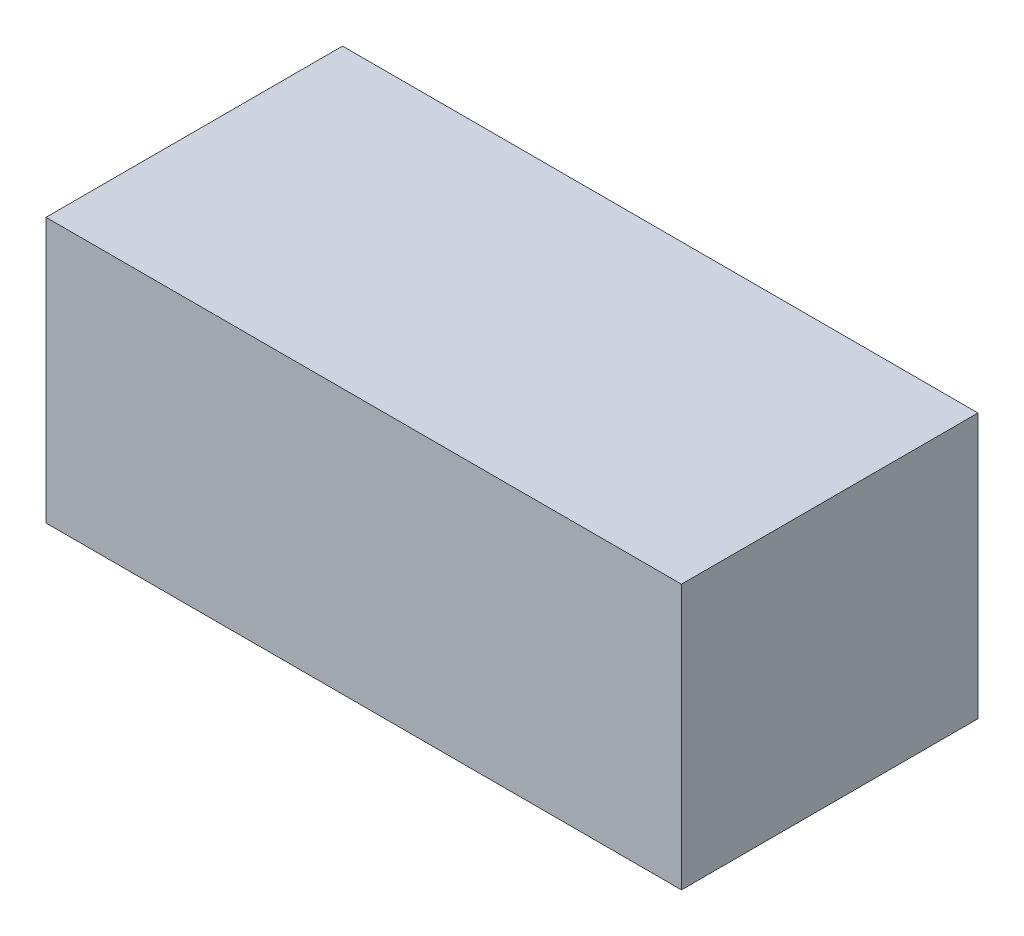
from build123d import *

# Parameters (mm, degrees)
SKETCH2_W           = 60
SKETCH2_H           = 28
BOSS_EXTRUDE1_DEPTH = 25


with BuildPart() as part:
    # Sketch2 → Boss-Extrude1 (new body)
    with BuildSketch(Plane(origin=(0, 0, 0), x_dir=(1, 0, 0), z_dir=(0, 1, 0))):
        Rectangle(SKETCH2_W, SKETCH2_H)
    extrude(amount=BOSS_EXTRUDE1_DEPTH)


solid = part.part
